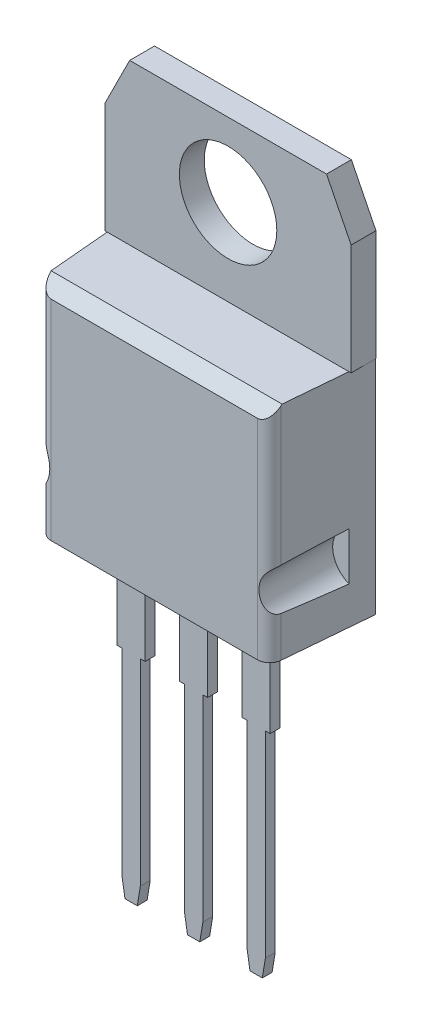
from build123d import *

# Parameters (mm, degrees)
SKETCH2_W                = 10
SKETCH2_H                = 9
BOSS_EXTRUDE1_DEPTH      = 4
CHAMFER1_SIZE            = 0.5
CUT_EXTRUDE1_DEPTH       = 3
BOSS_EXTRUDE2_DEPTH      = 0.4
LPATTERN1_COUNT          = 2
LPATTERN1_PITCH          = 2.54
LPATTERN2_COUNT          = 2
LPATTERN2_PITCH          = 2.54
DRAFT2_ANGLE             = -5
BOSS_EXTRUDE3_DEPTH      = 0.01
BOSS_EXTRUDE3_DEPTH_BACK = 1
SKETCH8_R                = 1.98
FILLET1_R                = 0.5


with BuildPart() as part:
    # Sketch2 → Boss-Extrude1 (new body)
    with BuildSketch(Plane.XY):
        Rectangle(SKETCH2_W, SKETCH2_H)
    extrude(amount=BOSS_EXTRUDE1_DEPTH)

    # Chamfer1
    chamfer1_edges = [part.edges().sort_by_distance(p)[0] for p in [
        (0, 4.5, 4),
    ]]
    chamfer(chamfer1_edges, length=CHAMFER1_SIZE)

    # Sketch6 → Cut-Extrude1 (cut)
    with BuildSketch(Plane.XY.offset(4)):
        with BuildLine():
            Line((5, -1), (5, -3))
            ThreePointArc((5, -3), (4.25, -2), (5, -1))
        make_face()
    cut_extrude1 = extrude(amount=-CUT_EXTRUDE1_DEPTH, mode=Mode.SUBTRACT)

    # Mirror1: Cut-Extrude1 across plane
    add(cut_extrude1.mirror(Plane(origin=(0, 0, 0), x_dir=(0, 0, 1), z_dir=(1, 0, 0))), mode=Mode.SUBTRACT)

    # Sketch7 → Boss-Extrude2 (add)
    with BuildSketch(Plane.XY.offset(2)):
        Polygon((-0.57, -4.5), (-0.57, -8.44), (-0.375, -8.44), (-0.375, -16.44), (-0.25, -17.2), (0.25, -17.2), (0.375, -16.44), (0.375, -8.44), (0.57, -8.44), (0.57, -4.5), align=None)
    boss_extrude2 = extrude(amount=BOSS_EXTRUDE2_DEPTH)

    # LPattern1: Boss-Extrude2 ×2
    with Locations(*[(-i * LPATTERN1_PITCH, 0, 0) for i in range(1, LPATTERN1_COUNT)]):
        add(boss_extrude2)

    # LPattern2: Boss-Extrude2 ×2
    with Locations(*[(i * LPATTERN2_PITCH, 0, 0) for i in range(1, LPATTERN2_COUNT)]):
        add(boss_extrude2)

    # Draft2
    draft2_faces = [part.faces().sort_by_distance(p)[0] for p in [
        (5, 0.383542538, 1.891910739),
        (-5, 0.383542538, 1.891910739),
    ]]
    draft(draft2_faces, Plane(origin=(0, 0, 0), x_dir=(-1, 0, 0), z_dir=(0, 0, -1)), DRAFT2_ANGLE)

    # Sketch8 → Boss-Extrude3 (add, two sides: drawn at the far end of the back side and taken through both)
    with BuildSketch(Plane(origin=(0, 0, 0), x_dir=(-1, 0, 0), z_dir=(0, 0, -1)).offset(-BOSS_EXTRUDE3_DEPTH_BACK)):
        Polygon((-5, 9), (-4, 11), (4, 11), (5, 9), (5, 4.5), (-5, 4.5), align=None)
        with Locations((0, 8)):
            Circle(SKETCH8_R, mode=Mode.SUBTRACT)
    extrude(amount=BOSS_EXTRUDE3_DEPTH + BOSS_EXTRUDE3_DEPTH_BACK)

    # Fillet1
    fillet1_edges = [part.edges().sort_by_distance(p)[0] for p in [
        (-4.650045346, 1.410302183, 4),
        (4.650045346, 1.410302183, 4),
    ]]
    fillet(fillet1_edges, radius=FILLET1_R)


solid = part.part
